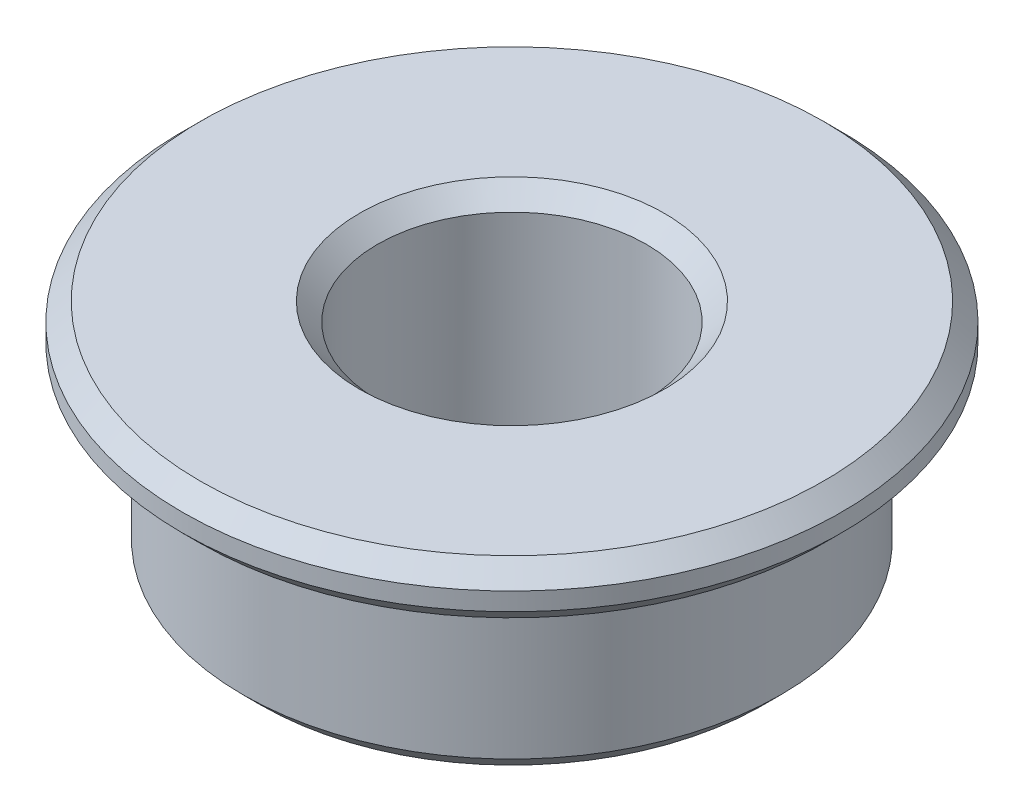
from build123d import *

# Parameters (mm, degrees)
SKETCH_1_R      = 3.675
SKETCH_1_R_2    = 1.5
EXTRUDE_1_DEPTH = 0.6
EXTRUDE_START   = 1.9
SKETCH_2_R      = 3
SKETCH_2_R_2    = 1.5
EXTRUDE_2_DEPTH = 1.9
CHAMFER_1_SIZE  = 0.2


with BuildPart() as part:
    # ｽｹｯﾁ1 → ﾎﾞｽ - 押し出し1 (new body)
    with BuildSketch(Plane(origin=(0, 0, 0), x_dir=(1, 0, 0), z_dir=(0, 1, 0))):
        Circle(SKETCH_1_R)
        Circle(SKETCH_1_R_2, mode=Mode.SUBTRACT)
    extrude(amount=EXTRUDE_1_DEPTH)

    # ｽｹｯﾁ2 → ﾎﾞｽ - 押し出し2 (add)
    with BuildSketch(Plane.XZ.offset(EXTRUDE_START)):
        Circle(SKETCH_2_R)
        Circle(SKETCH_2_R_2, mode=Mode.SUBTRACT)
    extrude(amount=-EXTRUDE_2_DEPTH)

    # 面取り1
    chamfer_1_edges = [part.edges().sort_by_distance(p)[0] for p in [
        (-1.5, -1.9, 0),
        (-3, -1.9, 0),
        (-1.5, 0.6, 0),
        (-3.675, 0.6, 0),
        (-3.675, 0, 0),
    ]]
    chamfer(chamfer_1_edges, length=CHAMFER_1_SIZE)


solid = part.part
